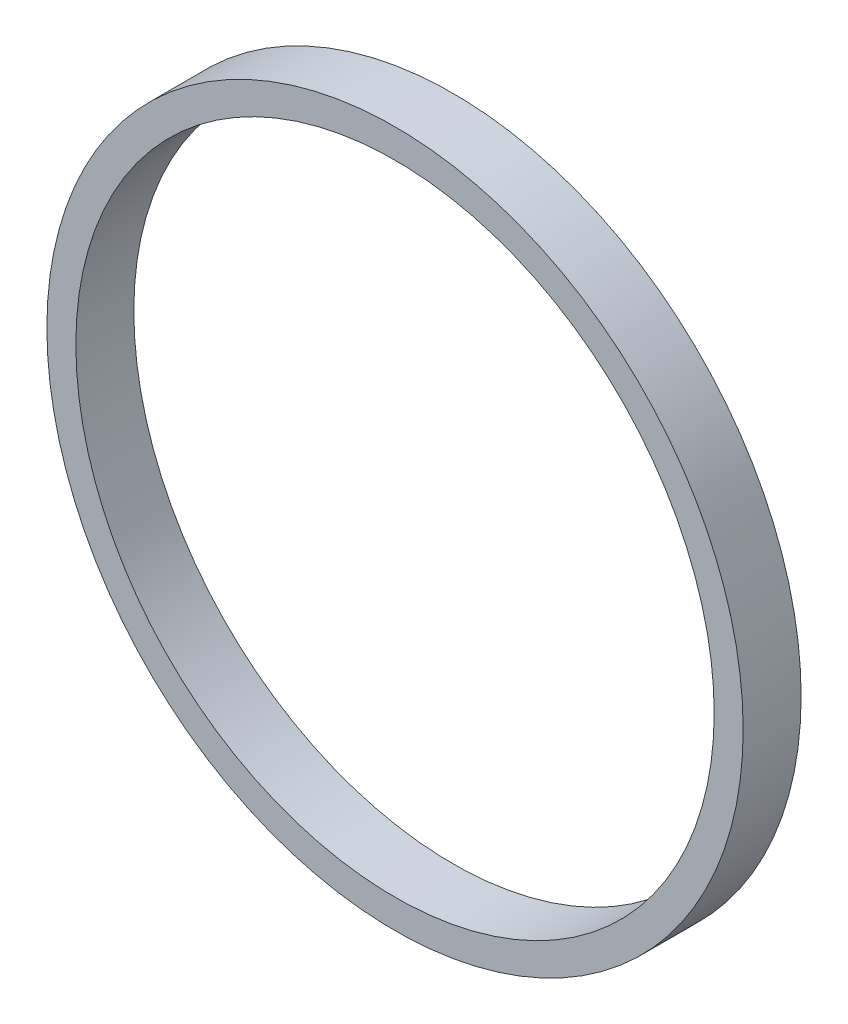
from build123d import *

# Parameters (mm, degrees)
SKETCH3_R           = 24.03
SKETCH3_R_2         = 22.03
BOSS_EXTRUDE3_DEPTH = 4


with BuildPart() as part:
    # Sketch3 → Boss-Extrude3 (new body)
    with BuildSketch(Plane.XY):
        Circle(SKETCH3_R)
        Circle(SKETCH3_R_2, mode=Mode.SUBTRACT)
    extrude(amount=BOSS_EXTRUDE3_DEPTH)


solid = part.part
